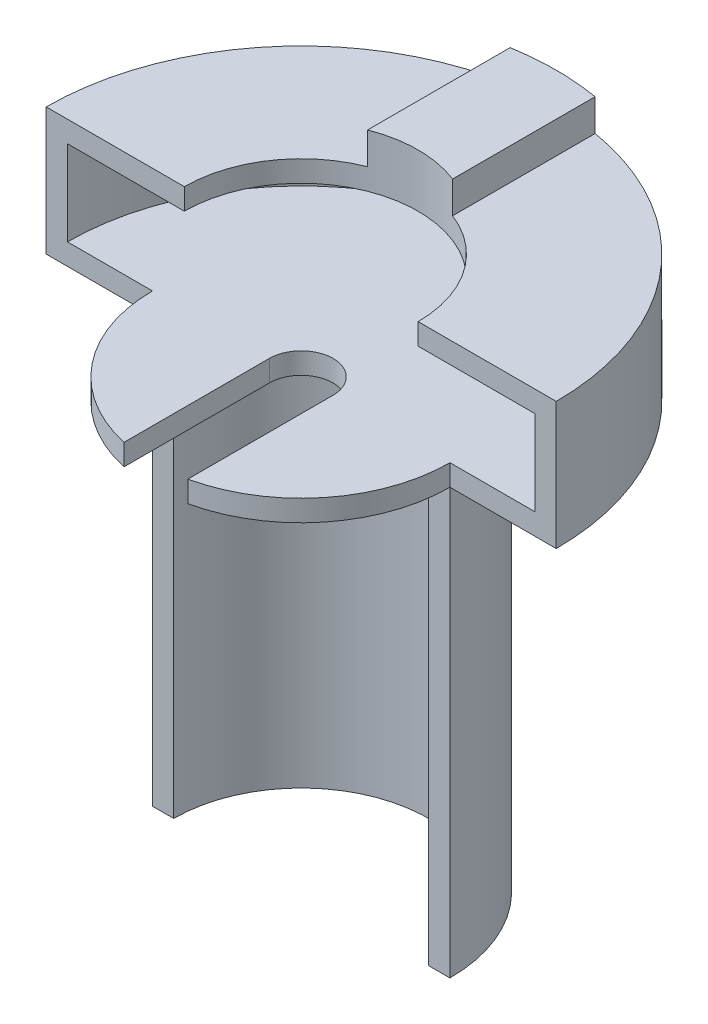
from build123d import *

# Parameters (mm, degrees)
MOTOR_FRONTPLATE_DEPTH = 2
MOTORKRYBBE_START      = 40
MOTORKRYBBE_DEPTH      = 40
BOSS_EXTRUDE4_DEPTH    = 8
BOSS_EXTRUDE5_DEPTH    = 2
BOSS_EXTRUDE6_DEPTH    = 3


with BuildPart() as part:
    # Sketch1 → Motor-frontplate (new body)
    with BuildSketch(Plane(origin=(0, 0, 0), x_dir=(1, 0, 0), z_dir=(0, 1, 0))):
        with BuildLine():
            ThreePointArc((-3, 0), (0, 3), (3, 0))
            Line((3, 0), (3, -13.674794331))
            ThreePointArc((3, -13.674794331), (10.908712115, -8.774964387), (14, 0))
            Line((14, 0), (24, 0))
            ThreePointArc((24, 0), (0, 24), (-24, 0))
            Line((-24, 0), (-14, 0))
            ThreePointArc((-14, 0), (-10.908712115, -8.774964387), (-3, -13.674794331))
            Line((-3, -13.674794331), (-3, 0))
        make_face()
    extrude(amount=MOTOR_FRONTPLATE_DEPTH)

    # Sketch2 → Motorkrybbe (add)
    with BuildSketch(Plane.XZ.offset(MOTORKRYBBE_START)):
        with BuildLine():
            Line((-12, 0), (-14, 0))
            ThreePointArc((-14, 0), (0, -14), (14, 0))
            Line((14, 0), (12, 0))
            ThreePointArc((12, 0), (0, -12), (-12, 0))
        make_face()
    extrude(amount=-MOTORKRYBBE_DEPTH)

    # Sketch5 → Boss-Extrude4 (add)
    with BuildSketch(Plane(origin=(0, 2, 0), x_dir=(1, 0, 0), z_dir=(0, 1, 0))):
        with BuildLine():
            Line((-24, 0), (-22, 0))
            ThreePointArc((-22, 0), (0, 22), (22, 0))
            Line((22, 0), (24, 0))
            ThreePointArc((24, 0), (0, 24), (-24, 0))
        make_face()
    extrude(amount=BOSS_EXTRUDE4_DEPTH)

    # Sketch6 → Boss-Extrude5 (add)
    with BuildSketch(Plane(origin=(0, 10, 0), x_dir=(1, 0, 0), z_dir=(0, 1, 0))):
        with BuildLine():
            Line((-24, 0), (-11, 0))
            ThreePointArc((-11, 0), (0, 11), (11, 0))
            Line((11, 0), (24, 0))
            ThreePointArc((24, 0), (0, 24), (-24, 0))
        make_face()
    extrude(amount=BOSS_EXTRUDE5_DEPTH)

    # Sketch7 → Boss-Extrude6 (add)
    with BuildSketch(Plane(origin=(0, 12, 0), x_dir=(1, 0, 0), z_dir=(0, 1, 0))):
        with BuildLine():
            Line((-4, 10.246950766), (-4, 23.664319132))
            ThreePointArc((-4, 23.664319132), (0, 24), (4, 23.664319132))
            Line((4, 23.664319132), (4, 10.246950766))
            ThreePointArc((4, 10.246950766), (0, 11), (-4, 10.246950766))
        make_face()
    extrude(amount=BOSS_EXTRUDE6_DEPTH)


solid = part.part
